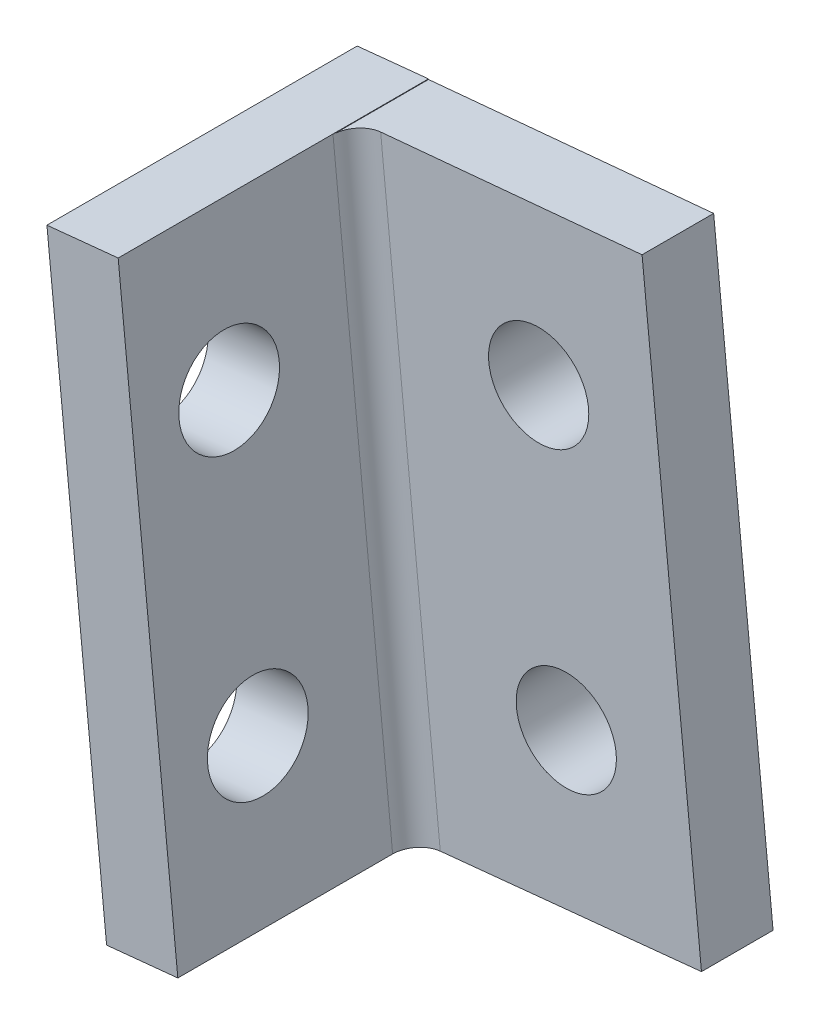
from build123d import *

# Parameters (mm, degrees)
SKETCH1_R           = 2.1
BOSS_EXTRUDE1_DEPTH = 3
SKETCH3_W           = 13
SKETCH3_H           = 25
SKETCH3_R           = 2.1
BOSS_EXTRUDE2_DEPTH = 3
FILLET1_R           = 1


with BuildPart() as part:
    # Sketch1 → Boss-Extrude1 (new body)
    with BuildSketch(Plane.XY):
        Polygon((-105, 44.736808962), (-102.5, 19.862123034), (-87.575188443, 21.362123034), (-90.064854898, 46.130164899), align=None)
        with Locations((-94.396840498, 39.233865601)):
            Circle(SKETCH1_R, mode=Mode.SUBTRACT)
        with Locations((-93.239490742, 27.289806762)):
            Circle(SKETCH1_R, mode=Mode.SUBTRACT)
    extrude(amount=BOSS_EXTRUDE1_DEPTH)

    # Sketch3 → Boss-Extrude2 (add)
    with BuildSketch(Plane(origin=(-99.498743711, -10, 0), x_dir=(0, 0, 1), z_dir=(-0.9949874371066202, -0.09999999999999917, 0))):
        with Locations((6.5, 42.512562893)):
            Rectangle(SKETCH3_W, SKETCH3_H)
        with Locations((9, 36.512562893)):
            Circle(SKETCH3_R, mode=Mode.SUBTRACT)
        with Locations((9, 48.512562893)):
            Circle(SKETCH3_R, mode=Mode.SUBTRACT)
    extrude(amount=-BOSS_EXTRUDE2_DEPTH)

    # Fillet1
    fillet1_edges = [part.edges().sort_by_distance(p)[0] for p in [
        (-100.763966233, 32.588805146, 3),
    ]]
    fillet(fillet1_edges, radius=FILLET1_R)


solid = part.part
